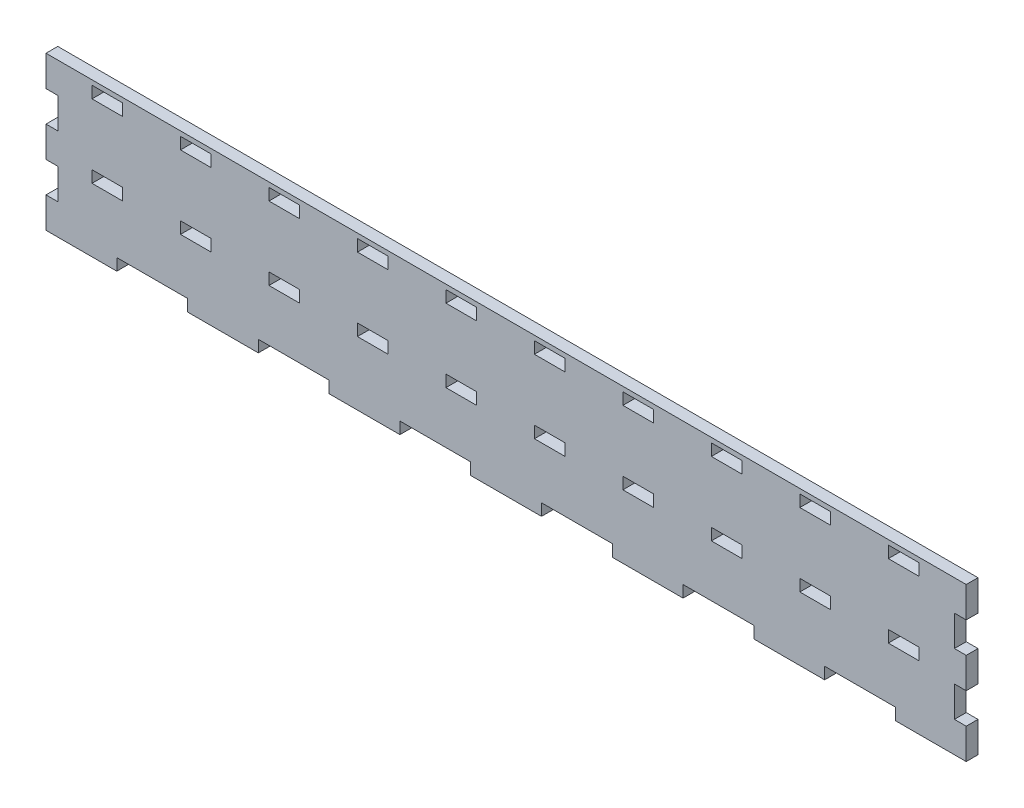
from build123d import *

# Parameters (mm, degrees)
ESQUISSE1_W                     = 390
ESQUISSE1_H                     = 65
BOSS_EXTRU_1_DEPTH              = 5
ESQUISSE2_W                     = 30
ESQUISSE2_H                     = 5
ENL_V_MAT_EXTRU_1_DEPTH         = 5
R_P_TITION_LIN_AIRE1_COUNT      = 6
R_P_TITION_LIN_AIRE1_PITCH      = 60
ESQUISSE3_W                     = 5
ESQUISSE3_H                     = 13
ENL_V_MAT_EXTRU_2_DEPTH         = 5
R_P_TITION_LIN_AIRE2_COUNT      = 2
R_P_TITION_LIN_AIRE2_PITCH      = 26
SYM_TRIE1_COPY_1_SKETCH_W       = 5
SYM_TRIE1_COPY_1_SKETCH_H       = 13
SYM_TRIE1_COPY_1_DEPTH          = 5
SYM_TRIE1_COPY_2_SKETCH_W       = 5
SYM_TRIE1_COPY_2_SKETCH_H       = 13
SYM_TRIE1_COPY_2_DEPTH          = 5
ESQUISSE4_W                     = 13
ESQUISSE4_H                     = 5
ENL_V_MAT_EXTRU_3_DEPTH         = 5
R_P_TITION_LIN_AIRE3_COUNT      = 2
R_P_TITION_LIN_AIRE3_PITCH      = 37.5
R_P_TITION_LIN_AIRE3_COUNT_DIR2 = 9
R_P_TITION_LIN_AIRE3_PITCH_DIR2 = 37.5


with BuildPart() as part:
    # Esquisse1 → Boss.-Extru.1 (new body)
    with BuildSketch(Plane.XY):
        with Locations((195, -32.5)):
            Rectangle(ESQUISSE1_W, ESQUISSE1_H)
    extrude(amount=BOSS_EXTRU_1_DEPTH)

    # Esquisse2 → Enlèv. mat.-Extru.1 (cut)
    with BuildSketch(Plane.XY.offset(5)):
        with Locations((45, -62.5)):
            Rectangle(ESQUISSE2_W, ESQUISSE2_H)
    enl_v_mat_extru_1 = extrude(amount=-ENL_V_MAT_EXTRU_1_DEPTH, mode=Mode.SUBTRACT)

    # Répétition linéaire1: Enlèv. mat.-Extru.1 ×6
    with Locations(*[(i * R_P_TITION_LIN_AIRE1_PITCH, 0, 0) for i in range(1, R_P_TITION_LIN_AIRE1_COUNT)]):
        add(enl_v_mat_extru_1, mode=Mode.SUBTRACT)

    # Esquisse3 → Enlèv. mat.-Extru.2 (cut)
    with BuildSketch(Plane.XY.offset(5)):
        with Locations((2.5, -45.5)):
            Rectangle(ESQUISSE3_W, ESQUISSE3_H)
    enl_v_mat_extru_2 = extrude(amount=-ENL_V_MAT_EXTRU_2_DEPTH, mode=Mode.SUBTRACT)

    # Répétition linéaire2: Enlèv. mat.-Extru.2 ×2
    with Locations(*[(0, i * R_P_TITION_LIN_AIRE2_PITCH, 0) for i in range(1, R_P_TITION_LIN_AIRE2_COUNT)]):
        add(enl_v_mat_extru_2, mode=Mode.SUBTRACT)

    # Symétrie1 copy 1 sketch → Symétrie1 copy 1 (cut)
    with BuildSketch(Plane(origin=(390, 26, 5), x_dir=(-1, 0, 0), z_dir=(0, 0, 1))):
        with Locations((2.5, 45.5)):
            Rectangle(SYM_TRIE1_COPY_1_SKETCH_W, SYM_TRIE1_COPY_1_SKETCH_H)
    extrude(amount=-SYM_TRIE1_COPY_1_DEPTH, mode=Mode.SUBTRACT)

    # Symétrie1 copy 2 sketch → Symétrie1 copy 2 (cut)
    with BuildSketch(Plane(origin=(390, 0, 5), x_dir=(-1, 0, 0), z_dir=(0, 0, 1))):
        with Locations((2.5, 45.5)):
            Rectangle(SYM_TRIE1_COPY_2_SKETCH_W, SYM_TRIE1_COPY_2_SKETCH_H)
    extrude(amount=-SYM_TRIE1_COPY_2_DEPTH, mode=Mode.SUBTRACT)

    # Esquisse4 → Enlèv. mat.-Extru.3 (cut)
    with BuildSketch(Plane.XY.offset(5)):
        with Locations((63.5, -35.5)):
            Rectangle(ESQUISSE4_W, ESQUISSE4_H)
        with Locations((63.5, -4.5)):
            Rectangle(ESQUISSE4_W, ESQUISSE4_H)
    enl_v_mat_extru_3 = extrude(amount=-ENL_V_MAT_EXTRU_3_DEPTH, mode=Mode.SUBTRACT)

    # Répétition linéaire3: Enl_v. mat.-Extru.3 2 × 9
    with Locations(*[Vector(-1, 0, 0) * (i * R_P_TITION_LIN_AIRE3_PITCH) + Vector(1, 0, 0) * (j * R_P_TITION_LIN_AIRE3_PITCH_DIR2) for i in range(R_P_TITION_LIN_AIRE3_COUNT) for j in range(R_P_TITION_LIN_AIRE3_COUNT_DIR2) if (i, j) != (0, 0)]):
        add(enl_v_mat_extru_3, mode=Mode.SUBTRACT)


solid = part.part
